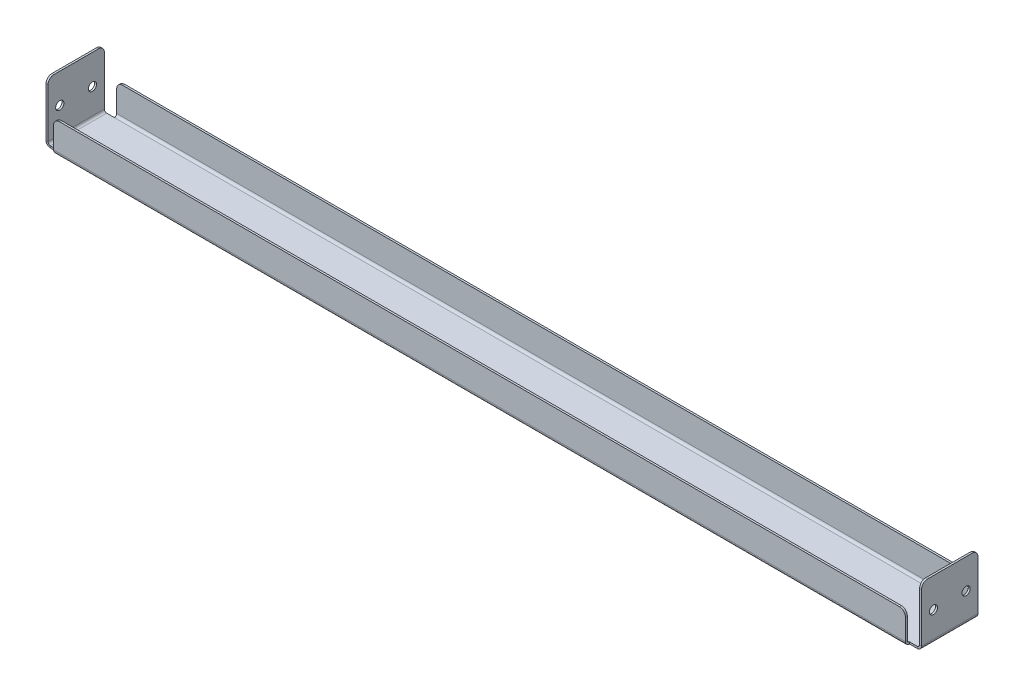
from build123d import *

# Parameters (mm, degrees)
SKETCH1_W                                 = 935.736
SKETCH1_H                                 = 60.325
BASE_FLANGE1_DEPTH                        = 2.05232
EDGE_FLANGE1_DEPTH                        = 910.336
EDGE_FLANGE1_BEND_DEPTH                   = 910.336
EDGE_FLANGE2_STRIP_W                      = 13.28928
EDGE_FLANGE2_STRIP_H                      = 2.05232
EDGE_FLANGE2_STRIP_CUT_DEPTH              = 60.325
EDGE_FLANGE2_STRIP_2_W                    = 13.28928
EDGE_FLANGE2_STRIP_2_H                    = 2.05232
EDGE_FLANGE2_STRIP_CUT_2_DEPTH            = 60.325
EDGE_FLANGE2_DEPTH                        = 60.325
EDGE_FLANGE2_BEND_DEPTH                   = 60.325
HOLE_FOR_1_4_SELF_CLINCHING_NUTS_S_SS_C_D = 8.7376
BREAK_CORNER1_DEPTH                       = 935.736
BREAK_CORNER1_START                       = -64.91732
BREAK_CORNER1_2_DEPTH                     = 69.50964


# Read off the part's stored shape, not the designer's step: Break-Corner1
# Sheet-metal steps are written as plain solids
with BuildPart() as part:
    # Sketch1 → Base-Flange1 (new body)
    with BuildSketch(Plane(origin=(0, 0, 0), x_dir=(1, 0, 0), z_dir=(0, 1, 0))):
        with Locations((467.868, 30.1625)):
            Rectangle(SKETCH1_W, SKETCH1_H)
    extrude(amount=-BASE_FLANGE1_DEPTH)

    # Edge-Flange1 section (across the edge) → Edge-Flange1 (add)
    with BuildSketch(Plane(origin=(923.036, 0, -62.865), x_dir=(0, 0, 1), z_dir=(-1, 0, 0))):
        with BuildLine():
            Line((-2.05232, 2.54), (-2.05232, 31.75))
            Line((-2.05232, 31.75), (0, 31.75))
            Line((0, 31.75), (0, 2.54))
            ThreePointArc((0, 2.54), (0.743948776, 0.743948776), (2.54, 0))
            Line((2.54, 0), (2.54, -2.05232))
            ThreePointArc((2.54, -2.05232), (-0.707260613, -0.707260613), (-2.05232, 2.54))
        make_face()
    extrude(amount=EDGE_FLANGE1_DEPTH)

    # Edge-Flange1 section 2 (across the edge) → Edge-Flange1 bend (add)
    with BuildSketch(Plane(origin=(12.7, 0, 2.54), x_dir=(0, 0, -1), z_dir=(1, 0, 0))):
        with BuildLine():
            Line((-2.05232, 2.54), (-2.05232, 31.75))
            Line((-2.05232, 31.75), (0, 31.75))
            Line((0, 31.75), (0, 2.54))
            ThreePointArc((0, 2.54), (0.743948776, 0.743948776), (2.54, 0))
            Line((2.54, 0), (2.54, -2.05232))
            ThreePointArc((2.54, -2.05232), (-0.707260613, -0.707260613), (-2.05232, 2.54))
        make_face()
    extrude(amount=EDGE_FLANGE1_BEND_DEPTH)

    # Edge-Flange2 strip (across the edge) → Edge-Flange2 strip cut (cut)
    with BuildSketch(Plane.XY.offset(-60.325)):
        with Locations((-2.05232, -1.02616)):
            Rectangle(EDGE_FLANGE2_STRIP_W, EDGE_FLANGE2_STRIP_H)
    extrude(amount=EDGE_FLANGE2_STRIP_CUT_DEPTH, mode=Mode.SUBTRACT)

    # Edge-Flange2 strip 2 (across the edge) → Edge-Flange2 strip cut 2 (cut)
    with BuildSketch(Plane(origin=(935.736, 0, 0), x_dir=(-1, 0, 0), z_dir=(0, 0, -1))):
        with Locations((-2.05232, -1.02616)):
            Rectangle(EDGE_FLANGE2_STRIP_2_W, EDGE_FLANGE2_STRIP_2_H)
    extrude(amount=EDGE_FLANGE2_STRIP_CUT_2_DEPTH, mode=Mode.SUBTRACT)

    # Edge-Flange2 section (across the edge) → Edge-Flange2 (add)
    with BuildSketch(Plane.XY.offset(-60.325)):
        with BuildLine():
            Line((0, 2.54), (0, 61.44768))
            Line((0, 61.44768), (2.05232, 61.44768))
            Line((2.05232, 61.44768), (2.05232, 2.54))
            ThreePointArc((2.05232, 2.54), (2.796268776, 0.743948776), (4.59232, 0))
            Line((4.59232, 0), (4.59232, -2.05232))
            ThreePointArc((4.59232, -2.05232), (1.345059387, -0.707260613), (0, 2.54))
        make_face()
    extrude(amount=EDGE_FLANGE2_DEPTH)

    # Edge-Flange2 section 2 (across the edge) → Edge-Flange2 bend (add)
    with BuildSketch(Plane(origin=(935.736, 0, 0), x_dir=(-1, 0, 0), z_dir=(0, 0, -1))):
        with BuildLine():
            Line((0, 2.54), (0, 61.44768))
            Line((0, 61.44768), (2.05232, 61.44768))
            Line((2.05232, 61.44768), (2.05232, 2.54))
            ThreePointArc((2.05232, 2.54), (2.796268776, 0.743948776), (4.59232, 0))
            Line((4.59232, 0), (4.59232, -2.05232))
            ThreePointArc((4.59232, -2.05232), (1.345059387, -0.707260613), (0, 2.54))
        make_face()
    extrude(amount=EDGE_FLANGE2_BEND_DEPTH)

    # Hole for 1/4 Self-clinching Nuts (S,SS,CLS,CLSS)1 (through all)
    with Locations(Plane.ZY):
        with Locations((-47.625, 29.69768), (-12.7, 29.69768)):
            Hole(HOLE_FOR_1_4_SELF_CLINCHING_NUTS_S_SS_C_D / 2)

    # Break-Corner1 outline → Break-Corner1 (cut)
    with BuildSketch(Plane.YZ):
        with BuildLine():
            ThreePointArc((55.09768, 0), (59.587808061, -1.859871939), (61.44768, -6.35))
            Line((61.44768, -6.35), (61.44768, 0))
            Line((61.44768, 0), (55.09768, 0))
        make_face()
        with BuildLine():
            Line((61.44768, -60.325), (61.44768, -53.975))
            ThreePointArc((61.44768, -53.975), (59.587808061, -58.465128061), (55.09768, -60.325))
            Line((55.09768, -60.325), (61.44768, -60.325))
        make_face()
    extrude(amount=BREAK_CORNER1_DEPTH, mode=Mode.SUBTRACT)

    # Break-Corner1 2 outline → Break-Corner1 2 (cut)
    with BuildSketch(Plane.XY.offset(BREAK_CORNER1_START)):
        with BuildLine():
            Line((12.7, 31.75), (12.7, 25.4))
            ThreePointArc((12.7, 25.4), (14.559871939, 29.890128061), (19.05, 31.75))
            Line((19.05, 31.75), (12.7, 31.75))
        make_face()
        with BuildLine():
            Line((923.036, 31.75), (916.686, 31.75))
            ThreePointArc((916.686, 31.75), (921.176128061, 29.890128061), (923.036, 25.4))
            Line((923.036, 25.4), (923.036, 31.75))
        make_face()
    extrude(amount=BREAK_CORNER1_2_DEPTH, mode=Mode.SUBTRACT)


solid = part.part
